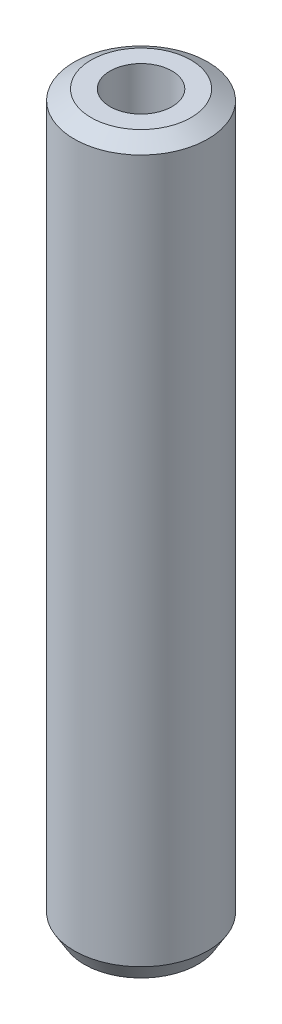
from build123d import *
from OCP.BRepFilletAPI import BRepFilletAPI_MakeChamfer

# Parameters (mm, degrees)
SKETCH1_R           = 7.5
BOSS_EXTRUDE1_DEPTH = 81.937245582
SKETCH2_R           = 3.475646885
CUT_EXTRUDE1_DEPTH  = 83.620894534
CHAMFER1_SIZE       = 1.136193138
CHAMFER1_SIZE2      = 1.894991753


with BuildPart() as part:
    # Sketch1 → Boss-Extrude1 (new body)
    with BuildSketch(Plane(origin=(0, 0, 0), x_dir=(1, 0, 0), z_dir=(0, 1, 0))):
        Circle(SKETCH1_R)
    extrude(amount=BOSS_EXTRUDE1_DEPTH)

    # Sketch2 → Cut-Extrude1 (cut, through all)
    with BuildSketch(Plane(origin=(0, 0, 0), x_dir=(1, 0, 0), z_dir=(0, 1, 0))):
        Circle(SKETCH2_R)
    extrude(amount=CUT_EXTRUDE1_DEPTH, mode=Mode.SUBTRACT)

    # Chamfer1: one chamfer whose edges measure the first distance from different faces: ONE call of the kernel's chamfer builder (chamfer() names one face for all edges)
    chamfer1_edges_1 = [part.edges().sort_by_distance(p)[0] for p in [
        (-7.5, 81.937245582, 0),
    ]]
    chamfer1_side_1 = [part.faces().sort_by_distance(p)[0] for p in [
        (-7.5, 40.968622791, 0),
    ]]
    chamfer1_edges_2 = [part.edges().sort_by_distance(p)[0] for p in [
        (-7.5, 0, 0),
    ]]
    chamfer1_side_2 = [part.faces().sort_by_distance(p)[0] for p in [
        (-7.287867966, 0, 0),
    ]]
    chamfer1 = BRepFilletAPI_MakeChamfer(part.part.solid().wrapped)
    for e in chamfer1_edges_1:
        chamfer1.Add(CHAMFER1_SIZE, CHAMFER1_SIZE2, e.wrapped, chamfer1_side_1[0].wrapped)  # the first distance lies on this face
    for e in chamfer1_edges_2:
        chamfer1.Add(CHAMFER1_SIZE, CHAMFER1_SIZE2, e.wrapped, chamfer1_side_2[0].wrapped)  # the first distance lies on this face
    add(Compound.cast(chamfer1.Shape()), mode=Mode.REPLACE)


solid = part.part
